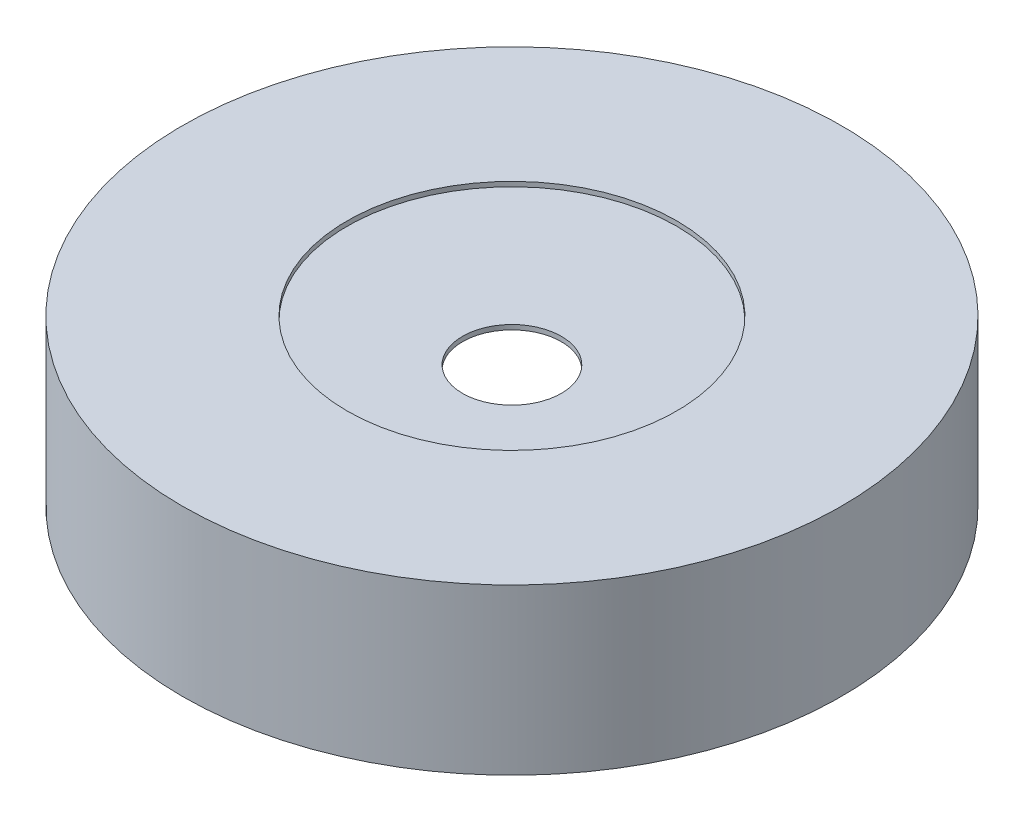
from build123d import *

# Parameters (mm, degrees)
SKETCH1_R           = 70
BOSS_EXTRUDE1_DEPTH = 35
SHELL6_T            = -10
BOSS_EXTRUDE3_DEPTH = 25
SHELL13_T           = -1
CIRPATTERN6_COUNT   = 4
CIRPATTERN7_DEPTH   = 26
SKETCH2_R           = 35
CUT_EXTRUDE5_DEPTH  = 7
SKETCH6_R           = 10.5
CUT_EXTRUDE6_DEPTH  = 7


# Read off the part's stored shape, not the designer's step: CirPattern7
with BuildPart() as part:
    # Sketch1 → Boss-Extrude1 (new body)
    with BuildSketch(Plane(origin=(0, 0, 0), x_dir=(1, 0, 0), z_dir=(0, 1, 0))):
        with Locations(Location((0, 0, 0), (0, 0, 270))):
            Circle(SKETCH1_R)
    extrude(amount=BOSS_EXTRUDE1_DEPTH)

    # Shell6
    shell6_openings = [part.faces().sort_by_distance(p)[0] for p in [
        (0, 0, 0),
    ]]
    offset(amount=SHELL6_T, openings=shell6_openings, kind=Kind.INTERSECTION)

    # Sketch5 → Boss-Extrude3 (add, through all)
    with BuildSketch(Plane.XZ.offset(-25)):
        Polygon((-55, 4.907477288), (-59.25, 2.453738644), (-59.25, -2.453738644), (-55, -4.907477288), (-50.75, -2.453738644), (-50.75, 2.453738644), align=None)
    boss_extrude3 = extrude(amount=BOSS_EXTRUDE3_DEPTH)

    # Shell13
    shell13_openings = [part.faces().sort_by_distance(p)[0] for p in [
        (-55, 0, 0),
    ]]
    offset(amount=SHELL13_T, openings=shell13_openings, kind=Kind.INTERSECTION)

    # CirPattern6: Boss-Extrude3 ×4 about axis
    cirpattern6_axis = Axis((0, 0, 0), (0, 1, 0))
    for i in range(1, CIRPATTERN6_COUNT):
        add(boss_extrude3.rotate(cirpattern6_axis, i * 360 / CIRPATTERN6_COUNT))

    # CirPattern7 outline → CirPattern7 (cut)
    with BuildSketch(Plane(origin=(0, 0, 0), x_dir=(1, 0, 0), z_dir=(0, 1, 0))):
        Polygon((-1.876388375, 51.75), (1.876388375, 51.75), (3.75277675, 55), (1.876388375, 58.25), (-1.876388375, 58.25), (-3.75277675, 55), align=None)
        Polygon((51.75, -1.876388375), (55, -3.75277675), (58.25, -1.876388375), (58.25, 1.876388375), (55, 3.75277675), (51.75, 1.876388375), align=None)
        Polygon((1.876388375, -51.75), (-1.876388375, -51.75), (-3.75277675, -55), (-1.876388375, -58.25), (1.876388375, -58.25), (3.75277675, -55), align=None)
    extrude(amount=CIRPATTERN7_DEPTH, mode=Mode.SUBTRACT)

    # Sketch2 → Cut-Extrude5 (cut)
    with BuildSketch(Plane(origin=(0, 35, 0), x_dir=(1, 0, 0), z_dir=(0, 1, 0))):
        with Locations(Location((0, 0, 0), (0, 0, 270))):
            Circle(SKETCH2_R)
    extrude(amount=-CUT_EXTRUDE5_DEPTH, mode=Mode.SUBTRACT)

    # Sketch6 → Cut-Extrude6 (cut)
    with BuildSketch(Plane(origin=(0, 26, 0), x_dir=(1, 0, 0), z_dir=(0, 1, 0))):
        with Locations(Location((0, 0, 0), (0, 0, 270))):
            Circle(SKETCH6_R)
    extrude(amount=-CUT_EXTRUDE6_DEPTH, mode=Mode.SUBTRACT)


solid = part.part
